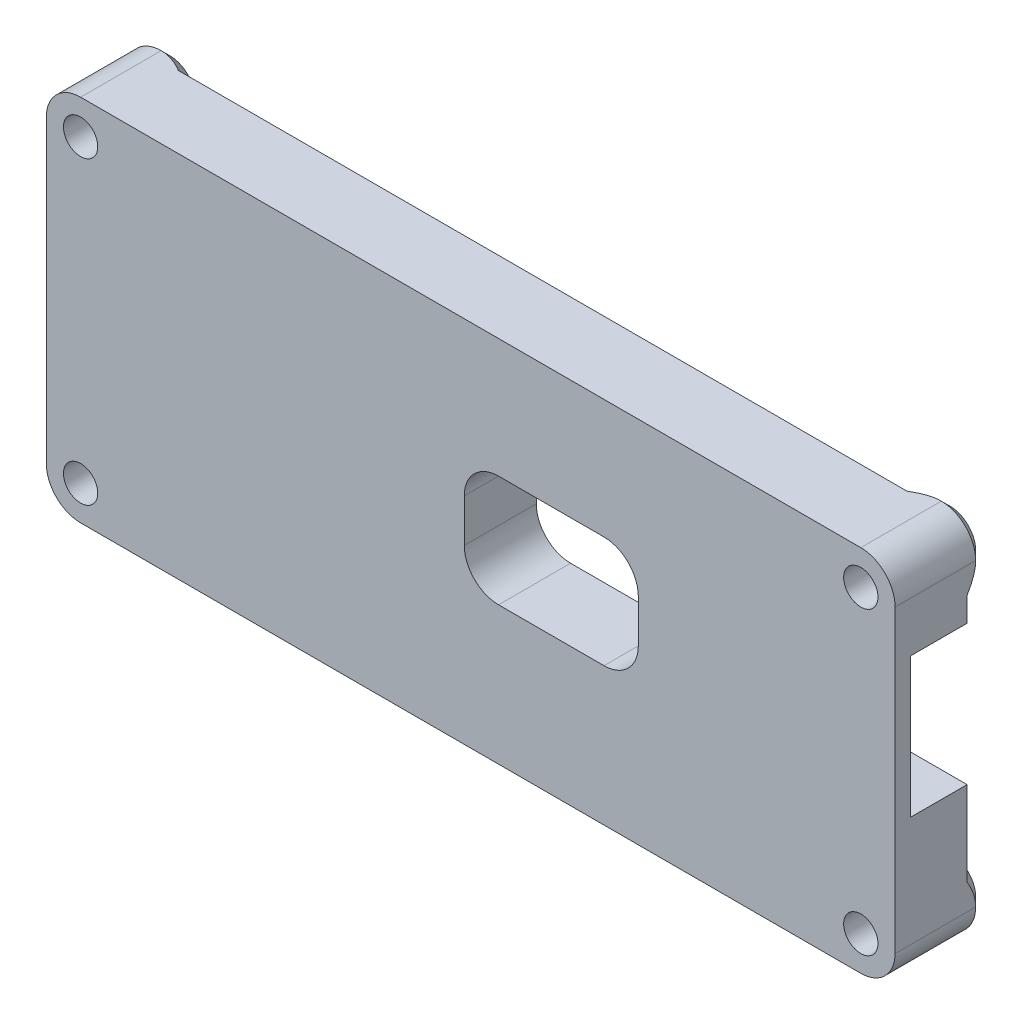
from build123d import *

# Parameters (mm, degrees)
SKETCH3_W           = 99
SKETCH3_H           = 43
SKETCH3_R           = 2
BOSS_EXTRUDE2_DEPTH = 8.399995141
BOSS_EXTRUDE3_START = 2
SKETCH4_R           = 3
SKETCH4_R_2         = 2
BOSS_EXTRUDE3_DEPTH = 2
CHAMFER1_SIZE       = 2
SKETCH5_W           = 8.599999433
SKETCH5_H           = 16.3
CUT_EXTRUDE1_DEPTH  = 19.390997243
CUT_EXTRUDE2_REACH  = 110.262
SKETCH6_W           = 20.299990895
SKETCH6_H           = 13.000003078
FILLET1_R           = 4


# Some blends are built 0.0001 mm under size
with BuildPart() as part:
    # Sketch3 → Boss-Extrude2 (new body)
    with BuildSketch(Plane.XY.offset(2)):
        with Locations((-49.5, 21.5)):
            Rectangle(SKETCH3_W, SKETCH3_H)
        with Locations(Location((-95, 39, 0), (0, 0, 270))):
            Circle(SKETCH3_R, mode=Mode.SUBTRACT)
        with Locations(Location((-95, 4, 0), (0, 0, 270))):
            Circle(SKETCH3_R, mode=Mode.SUBTRACT)
        with Locations(Location((-4, 4, 0), (0, 0, 270))):
            Circle(SKETCH3_R, mode=Mode.SUBTRACT)
        with Locations(Location((-4, 39, 0), (0, 0, 270))):
            Circle(SKETCH3_R, mode=Mode.SUBTRACT)
    extrude(amount=BOSS_EXTRUDE2_DEPTH)

    # Sketch4 → Boss-Extrude3 (add)
    # profile 1 of 4: a face of its own
    with BuildSketch(Plane(origin=(0, 0, 2), x_dir=(-1, 0, 0), z_dir=(0, 0, -1)).offset(BOSS_EXTRUDE3_START)):
        with Locations(Location((4, 39, 0), (0, 0, 180))):
            Circle(SKETCH4_R)
        with Locations(Location((4, 39, 0), (0, 0, 270))):
            Circle(SKETCH4_R_2, mode=Mode.SUBTRACT)
    # profile 2 of 4: a face of its own
    with BuildSketch(Plane(origin=(0, 0, 2), x_dir=(-1, 0, 0), z_dir=(0, 0, -1)).offset(BOSS_EXTRUDE3_START)):
        with Locations(Location((95, 39, 0), (0, 0, 180))):
            Circle(SKETCH4_R)
        with Locations(Location((95, 39, 0), (0, 0, 270))):
            Circle(SKETCH4_R_2, mode=Mode.SUBTRACT)
    # profile 3 of 4: a face of its own
    with BuildSketch(Plane(origin=(0, 0, 2), x_dir=(-1, 0, 0), z_dir=(0, 0, -1)).offset(BOSS_EXTRUDE3_START)):
        with Locations(Location((95, 4, 0), (0, 0, 180))):
            Circle(SKETCH4_R)
        with Locations(Location((95, 4, 0), (0, 0, 270))):
            Circle(SKETCH4_R_2, mode=Mode.SUBTRACT)
    # profile 4 of 4: a face of its own
    with BuildSketch(Plane(origin=(0, 0, 2), x_dir=(-1, 0, 0), z_dir=(0, 0, -1)).offset(BOSS_EXTRUDE3_START)):
        with Locations(Location((4, 4, 0), (0, 0, 180))):
            Circle(SKETCH4_R)
        with Locations(Location((4, 4, 0), (0, 0, 270))):
            Circle(SKETCH4_R_2, mode=Mode.SUBTRACT)
    extrude(amount=-BOSS_EXTRUDE3_DEPTH)

    # Chamfer1
    # the kernel refuses this chamfer: 2 mm, written as the material it adds along each edge
    with BuildSketch(Plane(origin=(-4, 39, 2), x_dir=(1, 0, 0), z_dir=(0, 1, 0))) as chamfer1_piece_1_section:
        Polygon((3 + CHAMFER1_SIZE, 0), (3, CHAMFER1_SIZE), (3, 0), align=None)
    chamfer1_piece_1 = revolve(axis=Axis((-4, 39, 2), (0, 0, -1)), mode=Mode.PRIVATE)
    chamfer1_piece_1 = split(chamfer1_piece_1, bisect_by=Plane(origin=(-8.002812408, 43, 1.053756135), z_dir=(0, -1, 0)), keep=Keep.TOP, mode=Mode.PRIVATE)
    chamfer1_piece_1 = split(chamfer1_piece_1, bisect_by=Plane(origin=(0, 39, 1.053756135), z_dir=(-1, 0, 0)), keep=Keep.TOP, mode=Mode.PRIVATE)
    chamfer1_piece_1 = split(chamfer1_piece_1, bisect_by=Plane(origin=(-8.002812408, 39, 0), z_dir=(0, 0, 1)), keep=Keep.TOP, mode=Mode.PRIVATE)
    add(chamfer1_piece_1)
    with BuildSketch(Plane(origin=(-95, 39, 2), x_dir=(1, 0, 0), z_dir=(0, 1, 0))) as chamfer1_piece_2_section:
        Polygon((3 + CHAMFER1_SIZE, 0), (3, CHAMFER1_SIZE), (3, 0), align=None)
    chamfer1_piece_2 = revolve(axis=Axis((-95, 39, 2), (0, 0, -1)), mode=Mode.PRIVATE)
    chamfer1_piece_2 = split(chamfer1_piece_2, bisect_by=Plane(origin=(-92.655832372, 43, 1.739278981), z_dir=(0, -1, 0)), keep=Keep.TOP, mode=Mode.PRIVATE)
    chamfer1_piece_2 = split(chamfer1_piece_2, bisect_by=Plane(origin=(-99, 34.939782567, 1.739278981), z_dir=(1, 0, 0)), keep=Keep.TOP, mode=Mode.PRIVATE)
    chamfer1_piece_2 = split(chamfer1_piece_2, bisect_by=Plane(origin=(-92.655832372, 34.939782567, 0), z_dir=(0, 0, 1)), keep=Keep.TOP, mode=Mode.PRIVATE)
    add(chamfer1_piece_2)
    with BuildSketch(Plane(origin=(-95, 4, 2), x_dir=(1, 0, 0), z_dir=(0, 1, 0))) as chamfer1_piece_3_section:
        Polygon((3 + CHAMFER1_SIZE, 0), (3, CHAMFER1_SIZE), (3, 0), align=None)
    chamfer1_piece_3 = revolve(axis=Axis((-95, 4, 2), (0, 0, -1)), mode=Mode.PRIVATE)
    chamfer1_piece_3 = split(chamfer1_piece_3, bisect_by=Plane(origin=(-99, 0.533462766, 1.053756132), z_dir=(1, 0, 0)), keep=Keep.TOP, mode=Mode.PRIVATE)
    chamfer1_piece_3 = split(chamfer1_piece_3, bisect_by=Plane(origin=(-92.998593795, 0, 1.053756132), z_dir=(0, 1, 0)), keep=Keep.TOP, mode=Mode.PRIVATE)
    chamfer1_piece_3 = split(chamfer1_piece_3, bisect_by=Plane(origin=(-92.998593795, 0.533462766, 0), z_dir=(0, 0, 1)), keep=Keep.TOP, mode=Mode.PRIVATE)
    add(chamfer1_piece_3)
    with BuildSketch(Plane(origin=(-4, 4, 2), x_dir=(1, 0, 0), z_dir=(0, 1, 0))) as chamfer1_piece_4_section:
        Polygon((3 + CHAMFER1_SIZE, 0), (3, CHAMFER1_SIZE), (3, 0), align=None)
    chamfer1_piece_4 = revolve(axis=Axis((-4, 4, 2), (0, 0, -1)), mode=Mode.PRIVATE)
    chamfer1_piece_4 = split(chamfer1_piece_4, bisect_by=Plane(origin=(0, 4, 1.053756135), z_dir=(-1, 0, 0)), keep=Keep.TOP, mode=Mode.PRIVATE)
    chamfer1_piece_4 = split(chamfer1_piece_4, bisect_by=Plane(origin=(-8.002812408, 0, 1.053756135), z_dir=(0, 1, 0)), keep=Keep.TOP, mode=Mode.PRIVATE)
    chamfer1_piece_4 = split(chamfer1_piece_4, bisect_by=Plane(origin=(-8.002812408, 4, 0), z_dir=(0, 0, 1)), keep=Keep.TOP, mode=Mode.PRIVATE)
    add(chamfer1_piece_4)

    # Sketch5 → Cut-Extrude1 (cut)
    with BuildSketch(Plane(origin=(0, 0, 0), x_dir=(0, 0, -1), z_dir=(1, 0, 0))):
        with Locations((-4.299999717, 25.013003939)):
            Rectangle(SKETCH5_W, SKETCH5_H)
    extrude(amount=-CUT_EXTRUDE1_DEPTH, mode=Mode.SUBTRACT)

    # Sketch6 → Cut-Extrude2 (cut, up to next)
    with BuildSketch(Plane(origin=(0, 0, 2), x_dir=(-1, 0, 0), z_dir=(0, 0, -1)), mode=Mode.PRIVATE) as cut_extrude2_sk1:
        with Locations((40.099996563, 22.600000838)):
            Rectangle(SKETCH6_W, SKETCH6_H)
    cut_extrude2_tool1 = extrude(cut_extrude2_sk1.sketch, amount=-CUT_EXTRUDE2_REACH, mode=Mode.PRIVATE) & part.part
    add(cut_extrude2_tool1.solids().sort_by_distance((-40.099997, 22.600001, 2))[0], mode=Mode.SUBTRACT)

    # Fillet1
    fillet1_edges = [part.edges().sort_by_distance(p)[0] for p in [
        (-50.249992011, 16.099999299, 6.19999757),
        (-50.249992011, 29.100002377, 6.19999757),
        (-29.950001116, 29.100002377, 6.19999757),
        (-29.950001116, 16.099999299, 6.19999757),
        (-99, 0, 6.19999757),
        (0, 0, 6.19999757),
        (0, 43, 6.19999757),
        (-99, 43, 6.19999757),
    ]]
    fillet(fillet1_edges, radius=FILLET1_R - 0.0001)  # a hair under: the kernel refuses the full size


solid = part.part
